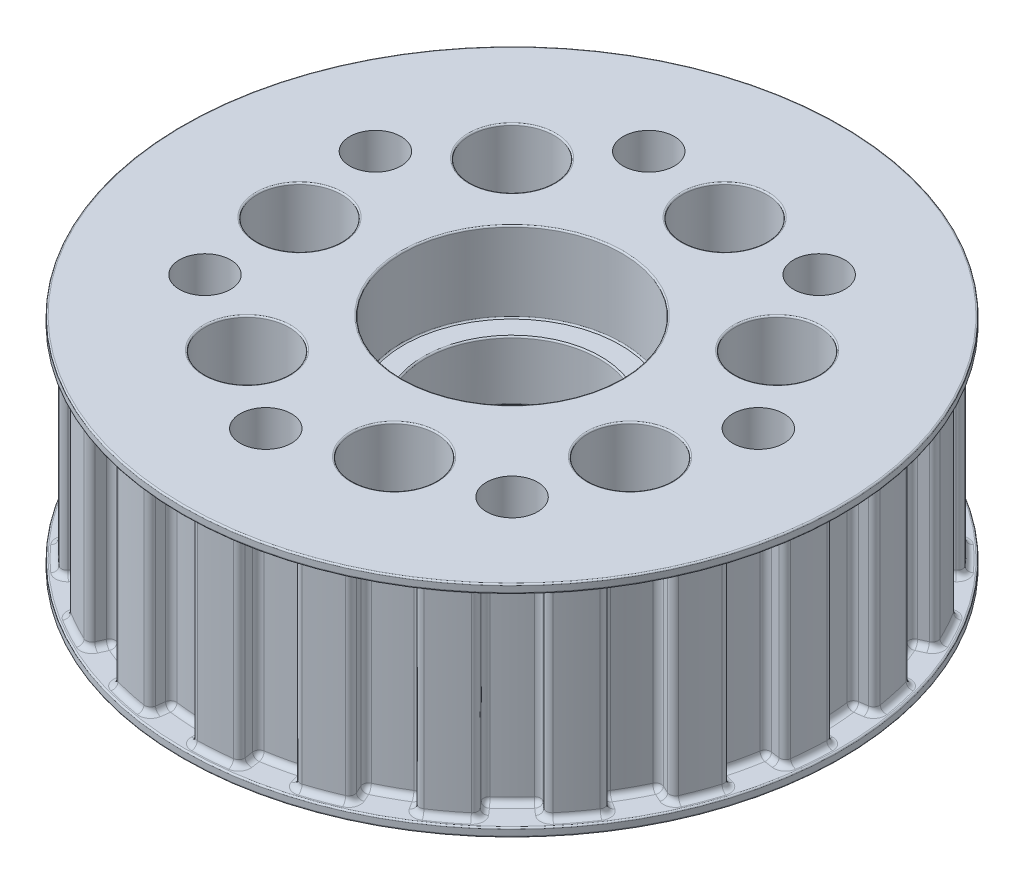
from build123d import *

# Parameters (mm, degrees)
SKIZZE1_R                       = 45
AUFSATZ_LINEAR_AUSTRAGEN1_DEPTH = 15
SKIZZE2_R                       = 15
SCHNITT_LINEAR_AUSTRAGEN1_DEPTH = 10.925
SKIZZE3_R                       = 11.9
SCHNITT_LINEAR_AUSTRAGEN2_DEPTH = 67.436854418
SCHNITT_LINEAR_AUSTRAGEN3_DEPTH = 27.6
KREISMUSTER1_COUNT              = 22
SKIZZE6_R                       = 55.110914616
SKIZZE6_R_2                     = 43.8
SCHNITT_LINEAR_AUSTRAGEN5_DEPTH = 27.6
VERRUNDUNG1_R                   = 0.8
DURCHGANGSLOCH_F_R_M101_D       = 11.5
KREISMUSTER3_COUNT              = 7
VERRUNDUNG5_R                   = 0.2
DURCHGANGSLOCH_F_R_M102_D       = 7
KREISMUSTER4_COUNT              = 7


with BuildPart() as part:
    # Skizze1 → Aufsatz-Linear austragen1 (new, symmetric)
    with BuildSketch(Plane(origin=(0, 0, 0), x_dir=(1, 0, 0), z_dir=(0, 1, 0))):
        with Locations(Location((0, 0, 0), (0, 0, 270))):
            Circle(SKIZZE1_R)
    extrude(amount=AUFSATZ_LINEAR_AUSTRAGEN1_DEPTH, both=True)

    # Skizze2 → Schnitt-Linear austragen1 (cut)
    with BuildSketch(Plane(origin=(0, 15, 0), x_dir=(1, 0, 0), z_dir=(0, 1, 0))):
        with Locations(Location((0, 0, 0), (0, 0, 270))):
            Circle(SKIZZE2_R)
    schnitt_linear_austragen1 = extrude(amount=-SCHNITT_LINEAR_AUSTRAGEN1_DEPTH, mode=Mode.SUBTRACT)

    # Spiegeln1: Schnitt-Linear austragen1 across plane
    add(schnitt_linear_austragen1.mirror(Plane.ZX), mode=Mode.SUBTRACT)

    # Skizze3 → Schnitt-Linear austragen2 (cut, through all)
    with BuildSketch(Plane.XZ.offset(4.075)):
        with Locations(Location((0, 0, 0), (0, 0, 270))):
            Circle(SKIZZE3_R)
    extrude(amount=-SCHNITT_LINEAR_AUSTRAGEN2_DEPTH, mode=Mode.SUBTRACT)

    # Skizze4 → Schnitt-Linear austragen3 (cut)
    with BuildSketch(Plane(origin=(0, 13.8, 0), x_dir=(1, 0, 0), z_dir=(0, 1, 0))):
        with BuildLine():
            Line((0, 47.039511304), (0, 41))
            ThreePointArc((0, 41), (2.924906511, 40.895536699), (5.834908369, 40.582679117))
            Line((5.834908369, 40.582679117), (6.694420444, 46.560716904))
            ThreePointArc((6.694420444, 46.560716904), (3.355760315, 46.91966002), (0, 47.039511304))
        make_face()
    schnitt_linear_austragen3 = extrude(amount=-SCHNITT_LINEAR_AUSTRAGEN3_DEPTH, mode=Mode.SUBTRACT)

    # Kreismuster1: Schnitt-Linear austragen3 ×22 about axis
    kreismuster1_axis = Axis((0, 0, 0), (0, 1, 0))
    for i in range(1, KREISMUSTER1_COUNT):
        add(schnitt_linear_austragen3.rotate(kreismuster1_axis, i * 360 / KREISMUSTER1_COUNT), mode=Mode.SUBTRACT)

    # Skizze6 → Schnitt-Linear austragen5 (cut)
    with BuildSketch(Plane(origin=(0, 13.8, 0), x_dir=(1, 0, 0), z_dir=(0, 1, 0))):
        Circle(SKIZZE6_R)
        Circle(SKIZZE6_R_2, mode=Mode.SUBTRACT)
    extrude(amount=-SCHNITT_LINEAR_AUSTRAGEN5_DEPTH, mode=Mode.SUBTRACT)

    # Verrundung1
    verrundung1_edges = [part.edges().sort_by_distance(p)[0] for p in [
        (37.29491181, 0, 17.032015533),
        (35.669149792, -13.8, 22.92317066),
        (35.669149792, 13.8, 22.92317066),
        (35.984838572, 13.8, 19.649208456),
        (35.984838572, -13.8, 19.649208456),
        (34.491394846, 0, 22.166273516),
        (30.985732549, 0, 26.849290092),
        (27.766095119, -13.8, 32.043781953),
        (27.766095119, 13.8, 32.043781953),
        (28.991378029, 13.8, 28.991378029),
        (28.991378029, -13.8, 28.991378029),
        (26.849290092, 0, 30.985732549),
        (22.166273516, 0, 34.491394846),
        (17.613596551, -13.8, 38.568396603),
        (17.613596551, 13.8, 38.568396603),
        (19.649208456, 13.8, 35.984838572),
        (19.649208456, -13.8, 35.984838572),
        (17.032015533, 0, 37.29491181),
        (11.55103483, 0, 39.339211918),
        (6.034149143, -13.8, 41.968429136),
        (6.034149143, 13.8, 41.968429136),
        (8.715176872, 13.8, 40.063021505),
        (8.715176872, -13.8, 40.063021505),
        (5.834908369, 0, 40.582679117),
        (0, 0, 41),
        (-6.034149143, -13.8, 41.968429136),
        (-6.034149143, 13.8, 41.968429136),
        (-2.924906511, 13.8, 40.895536699),
        (-2.924906511, -13.8, 40.895536699),
        (-5.834908369, 0, 40.582679117),
        (-11.55103483, 0, 39.339211918),
        (-17.613596551, -13.8, 38.568396603),
        (-17.613596551, 13.8, 38.568396603),
        (-14.328031364, 13.8, 38.414938725),
        (-14.328031364, -13.8, 38.414938725),
        (-17.032015533, 0, 37.29491181),
        (-22.166273516, 0, 34.491394846),
        (-27.766095119, -13.8, 32.043781953),
        (-27.766095119, 13.8, 32.043781953),
        (-24.570384327, 13.8, 32.822190878),
        (-24.570384327, -13.8, 32.822190878),
        (-26.849290092, 0, 30.985732549),
        (-30.985732549, 0, 26.849290092),
        (-35.669149792, -13.8, 22.92317066),
        (-35.669149792, 13.8, 22.92317066),
        (-32.822190878, 13.8, 24.570384327),
        (-32.822190878, -13.8, 24.570384327),
        (-34.491394846, 0, 22.166273516),
        (-37.29491181, 0, 17.032015533),
        (-40.682502081, -13.8, 11.94546041),
        (-40.682502081, 13.8, 11.94546041),
        (-38.414938725, 13.8, 14.328031364),
        (-38.414938725, -13.8, 14.328031364),
        (-39.339211918, 0, 11.55103483),
        (-40.582679117, 0, 5.834908369),
        (-42.4, -13.8, 0),
        (-42.4, 13.8, 0),
        (-40.895536699, 13.8, 2.924906511),
        (-40.895536699, -13.8, 2.924906511),
        (-41, 0, 0),
        (-40.582679117, 0, -5.834908369),
        (-40.682502081, -13.8, -11.94546041),
        (-40.682502081, 13.8, -11.94546041),
        (-40.063021505, 13.8, -8.715176872),
        (-40.063021505, -13.8, -8.715176872),
        (-39.339211918, 0, -11.55103483),
        (-37.29491181, 0, -17.032015533),
        (-35.669149792, -13.8, -22.92317066),
        (-35.669149792, 13.8, -22.92317066),
        (-35.984838572, 13.8, -19.649208456),
        (-35.984838572, -13.8, -19.649208456),
        (-34.491394846, 0, -22.166273516),
        (-30.985732549, 0, -26.849290092),
        (-27.766095119, -13.8, -32.043781953),
        (-27.766095119, 13.8, -32.043781953),
        (-28.991378029, 13.8, -28.991378029),
        (-28.991378029, -13.8, -28.991378029),
        (-26.849290092, 0, -30.985732549),
        (-22.166273516, 0, -34.491394846),
        (-17.613596551, -13.8, -38.568396603),
        (-17.613596551, 13.8, -38.568396603),
        (-19.649208456, 13.8, -35.984838572),
        (-19.649208456, -13.8, -35.984838572),
        (-17.032015533, 0, -37.29491181),
        (37.29491181, 0, -17.032015533),
        (40.682502081, -13.8, -11.94546041),
        (40.682502081, 13.8, -11.94546041),
        (38.414938725, 13.8, -14.328031364),
        (38.414938725, -13.8, -14.328031364),
        (39.339211918, 0, -11.55103483),
        (30.985732549, 0, -26.849290092),
        (35.669149792, -13.8, -22.92317066),
        (35.669149792, 13.8, -22.92317066),
        (32.822190878, 13.8, -24.570384327),
        (32.822190878, -13.8, -24.570384327),
        (34.491394846, 0, -22.166273516),
        (22.166273516, 0, -34.491394846),
        (27.766095119, -13.8, -32.043781953),
        (27.766095119, 13.8, -32.043781953),
        (24.570384327, 13.8, -32.822190878),
        (24.570384327, -13.8, -32.822190878),
        (26.849290092, 0, -30.985732549),
        (11.55103483, 0, -39.339211918),
        (17.613596551, -13.8, -38.568396603),
        (17.613596551, 13.8, -38.568396603),
        (14.328031364, 13.8, -38.414938725),
        (14.328031364, -13.8, -38.414938725),
        (17.032015533, 0, -37.29491181),
        (-11.55103483, 0, -39.339211918),
        (-6.034149143, -13.8, -41.968429136),
        (-6.034149143, 13.8, -41.968429136),
        (-8.715176872, 13.8, -40.063021505),
        (-8.715176872, -13.8, -40.063021505),
        (-5.834908369, 0, -40.582679117),
        (0, 0, -41),
        (6.034149143, -13.8, -41.968429136),
        (6.034149143, 13.8, -41.968429136),
        (2.924906511, 13.8, -40.895536699),
        (2.924906511, -13.8, -40.895536699),
        (5.834908369, 0, -40.582679117),
        (41.968429136, 13.8, -6.034149143),
        (41.968429136, -13.8, -6.034149143),
        (41.968429136, 13.8, 6.034149143),
        (41.968429136, -13.8, 6.034149143),
        (38.568396603, 13.8, 17.613596551),
        (38.568396603, -13.8, 17.613596551),
        (32.043781953, 13.8, 27.766095119),
        (32.043781953, -13.8, 27.766095119),
        (22.92317066, 13.8, 35.669149792),
        (22.92317066, -13.8, 35.669149792),
        (11.94546041, 13.8, 40.682502081),
        (11.94546041, -13.8, 40.682502081),
        (0, 13.8, 42.4),
        (0, -13.8, 42.4),
        (-11.94546041, 13.8, 40.682502081),
        (-11.94546041, -13.8, 40.682502081),
        (-22.92317066, 13.8, 35.669149792),
        (-22.92317066, -13.8, 35.669149792),
        (-32.043781953, 13.8, 27.766095119),
        (-32.043781953, -13.8, 27.766095119),
        (-38.568396603, 13.8, 17.613596551),
        (-38.568396603, -13.8, 17.613596551),
        (-41.968429136, 13.8, 6.034149143),
        (-41.968429136, -13.8, 6.034149143),
        (-41.968429136, 13.8, -6.034149143),
        (-41.968429136, -13.8, -6.034149143),
        (-38.568396603, 13.8, -17.613596551),
        (-38.568396603, -13.8, -17.613596551),
        (-32.043781953, 13.8, -27.766095119),
        (-32.043781953, -13.8, -27.766095119),
        (-22.92317066, 13.8, -35.669149792),
        (-22.92317066, -13.8, -35.669149792),
        (38.568396603, 13.8, -17.613596551),
        (38.568396603, -13.8, -17.613596551),
        (32.043781953, 13.8, -27.766095119),
        (32.043781953, -13.8, -27.766095119),
        (22.92317066, 13.8, -35.669149792),
        (22.92317066, -13.8, -35.669149792),
        (11.94546041, 13.8, -40.682502081),
        (11.94546041, -13.8, -40.682502081),
        (-11.94546041, 13.8, -40.682502081),
        (-11.94546041, -13.8, -40.682502081),
        (0, 13.8, -42.4),
        (0, -13.8, -42.4),
        (15.306531066, -13.8, 41.038397955),
        (26.248361793, -13.8, 35.063706352),
        (35.063706352, -13.8, 26.248361793),
        (41.038397955, -13.8, 15.306531066),
        (43.68840262, -13.8, 3.124656224),
        (42.79903273, -13.8, -9.310359682),
        (38.442339743, -13.8, -20.991105618),
        (30.971277016, -13.8, -30.971277016),
        (20.991105618, -13.8, -38.442339743),
        (9.310359682, -13.8, -42.79903273),
        (-3.124656224, -13.8, -43.68840262),
        (-15.306531066, -13.8, -41.038397955),
        (-26.248361793, -13.8, -35.063706352),
        (-35.063706352, -13.8, -26.248361793),
        (-41.038397955, -13.8, -15.306531066),
        (-43.68840262, -13.8, -3.124656224),
        (-42.79903273, -13.8, 9.310359682),
        (-38.442339743, -13.8, 20.991105618),
        (-30.971277016, -13.8, 30.971277016),
        (-20.991105618, -13.8, 38.442339743),
        (-9.310359682, -13.8, 42.79903273),
        (3.124656224, -13.8, 43.68840262),
        (-3.124656224, 13.8, -43.68840262),
        (9.310359682, 13.8, -42.79903273),
        (-15.306531066, 13.8, -41.038397955),
        (0, 0, -43.8),
        (6.233389916, 0, -43.354179154),
        (-12.33988599, 0, -42.025792244),
        (-6.233389916, 0, -43.354179154),
        (20.991105618, 13.8, -38.442339743),
        (12.33988599, 0, -42.025792244),
        (18.195177569, 0, -39.841881397),
        (30.971277016, 13.8, -30.971277016),
        (23.680067805, 0, -36.846904738),
        (28.682900147, 0, -33.101831357),
        (38.442339743, 13.8, -20.991105618),
        (33.101831357, 0, -28.682900147),
        (36.846904738, 0, -23.680067805),
        (42.79903273, 13.8, -9.310359682),
        (-26.248361793, 13.8, -35.063706352),
        (39.841881397, 0, -18.195177569),
        (42.025792244, 0, -12.33988599),
        (-35.063706352, 13.8, -26.248361793),
        (-23.680067805, 0, -36.846904738),
        (-18.195177569, 0, -39.841881397),
        (-41.038397955, 13.8, -15.306531066),
        (-33.101831357, 0, -28.682900147),
        (-28.682900147, 0, -33.101831357),
        (-43.68840262, 13.8, -3.124656224),
        (-39.841881397, 0, -18.195177569),
        (-36.846904738, 0, -23.680067805),
        (-42.79903273, 13.8, 9.310359682),
        (-43.354179154, 0, -6.233389916),
        (-42.025792244, 0, -12.33988599),
        (-38.442339743, 13.8, 20.991105618),
        (-43.354179154, 0, 6.233389916),
        (-43.8, 0, 0),
        (-30.971277016, 13.8, 30.971277016),
        (-39.841881397, 0, 18.195177569),
        (-42.025792244, 0, 12.33988599),
        (-20.991105618, 13.8, 38.442339743),
        (-33.101831357, 0, 28.682900147),
        (-36.846904738, 0, 23.680067805),
        (-9.310359682, 13.8, 42.79903273),
        (-23.680067805, 0, 36.846904738),
        (-28.682900147, 0, 33.101831357),
        (3.124656224, 13.8, 43.68840262),
        (-12.33988599, 0, 42.025792244),
        (-18.195177569, 0, 39.841881397),
        (15.306531066, 13.8, 41.038397955),
        (0, 0, 43.8),
        (-6.233389916, 0, 43.354179154),
        (26.248361793, 13.8, 35.063706352),
        (12.33988599, 0, 42.025792244),
        (6.233389916, 0, 43.354179154),
        (35.063706352, 13.8, 26.248361793),
        (23.680067805, 0, 36.846904738),
        (18.195177569, 0, 39.841881397),
        (41.038397955, 13.8, 15.306531066),
        (33.101831357, 0, 28.682900147),
        (28.682900147, 0, 33.101831357),
        (43.68840262, 13.8, 3.124656224),
        (39.841881397, 0, 18.195177569),
        (36.846904738, 0, 23.680067805),
        (43.354179154, 0, 6.233389916),
        (42.025792244, 0, 12.33988599),
        (43.354179154, 0, -6.233389916),
        (43.8, 0, 0),
        (40.582679117, 0, -5.834908369),
        (42.4, -13.8, 0),
        (42.4, 13.8, 0),
        (40.895536699, 13.8, -2.924906511),
        (40.895536699, -13.8, -2.924906511),
        (41, 0, 0),
        (40.582679117, 0, 5.834908369),
        (40.682502081, -13.8, 11.94546041),
        (40.682502081, 13.8, 11.94546041),
        (40.063021505, 13.8, 8.715176872),
        (40.063021505, -13.8, 8.715176872),
        (39.339211918, 0, 11.55103483),
    ]]
    fillet(verrundung1_edges, radius=VERRUNDUNG1_R)

    # Durchgangsloch für M101 (through all)
    with Locations(Plane(origin=(0, 15, 0), x_dir=(1, 0, 0), z_dir=(0, 1, 0))):
        with Locations((-18.561553006, 18.561553006)):
            durchgangsloch_f_r_m101 = Hole(DURCHGANGSLOCH_F_R_M101_D / 2)

    # Kreismuster3: Durchgangsloch für M101 ×7 about axis
    kreismuster3_axis = Axis((0, 0, 0), (0, 1, 0))
    for i in range(1, KREISMUSTER3_COUNT):
        add(durchgangsloch_f_r_m101.rotate(kreismuster3_axis, i * 360 / KREISMUSTER3_COUNT), mode=Mode.SUBTRACT)

    # Verrundung5
    verrundung5_edges = [part.edges().sort_by_distance(p)[0] for p in [
        (0, -15, -15),
        (0, -4.075, -15),
        (0, 4.075, 11.9),
        (0, -4.075, 11.9),
        (-12.811553006, 15, -18.561553006),
        (-12.811553006, -15, -18.561553006),
        (-22.499879149, 15, -1.556463527),
        (-22.499879149, -15, -1.556463527),
        (-15.245337379, 15, 16.620674735),
        (-15.245337379, -15, 16.620674735),
        (3.489254386, 15, 22.28210592),
        (3.489254386, -15, 22.28210592),
        (19.59636643, 15, 11.164656876),
        (19.59636643, -15, 11.164656876),
        (20.947014859, 15, -8.360006513),
        (20.947014859, -15, -8.360006513),
        (6.524133858, 15, -21.589414485),
        (6.524133858, -15, -21.589414485),
        (0, -15, -45),
        (0, 13.8, -45),
        (0, -13.8, -45),
        (0, 15, -45),
        (0, 4.075, -15),
        (0, 15, -15),
    ]]
    fillet(verrundung5_edges, radius=VERRUNDUNG5_R)

    # Durchgangsloch für M102 (through all)
    with Locations(Plane(origin=(0, 15, 0), x_dir=(1, 0, 0), z_dir=(0, 1, 0))):
        with Locations((-28.706153275, 10.044717468)):
            durchgangsloch_f_r_m102 = Hole(DURCHGANGSLOCH_F_R_M102_D / 2)

    # Kreismuster4: Durchgangsloch für M102 ×7 about axis
    kreismuster4_axis = Axis((0, 0, 0), (0, 1, 0))
    for i in range(1, KREISMUSTER4_COUNT):
        add(durchgangsloch_f_r_m102.rotate(kreismuster4_axis, i * 360 / KREISMUSTER4_COUNT), mode=Mode.SUBTRACT)


solid = part.part
